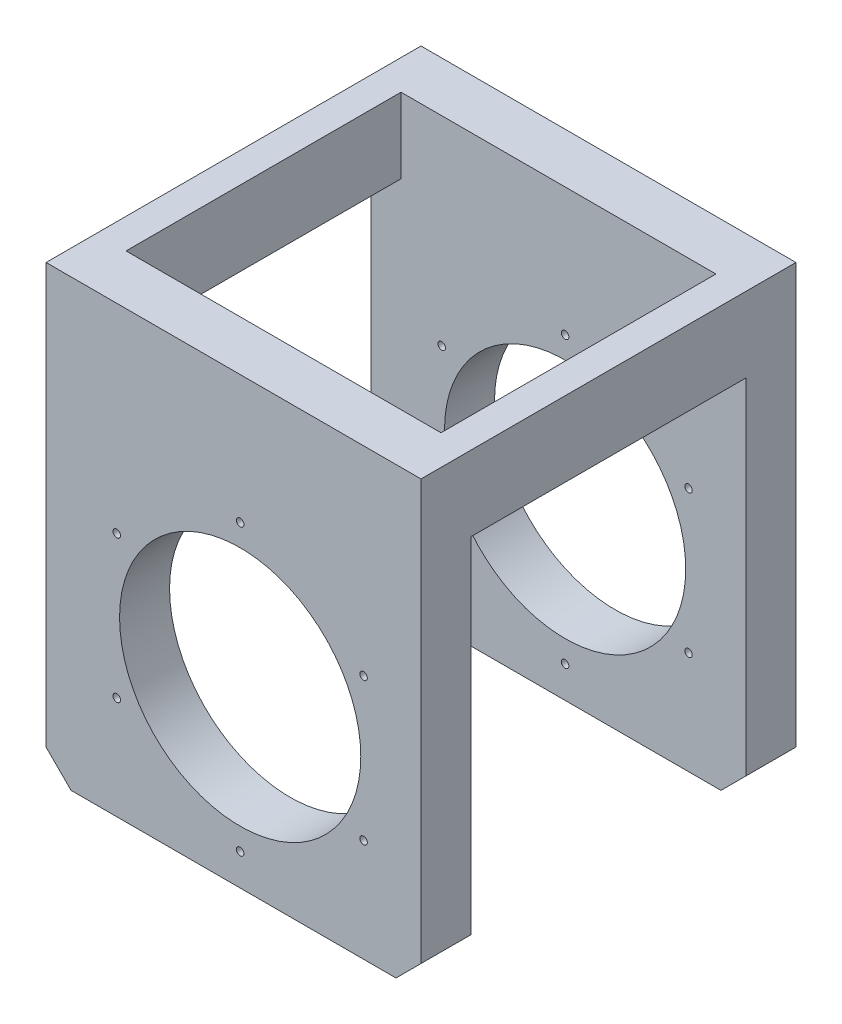
from build123d import *

# Parameters (mm, degrees)
EXTRUDE_1_OUTLINE_W     = 150
EXTRUDE_1_OUTLINE_H     = 400
EXTRUDE_1_OUTLINE_R     = 48.25
EXTRUDE_1_DEPTH         = 20
SKETCH_2_W              = 150
SKETCH_2_H              = 400
SKETCH_2_W_2            = 126
SKETCH_2_H_2            = 376
EXTRUDE_1_2_DEPTH       = 110
EXTRUDE_START           = 20
SKETCH_3_W              = 150
SKETCH_3_H              = 400
SKETCH_3_R              = 48.25
EXTRUDE_3_DEPTH         = 20
SKETCH_4_W              = 110
SKETCH_4_H              = 55
CUT_EXTRUDE_1_DEPTH     = 428.229446551
CHAMFER_2_SIZE          = 20
CHAMFER_3_SIZE          = 20
CUT_EXTRUDE_START       = 190
CUT_EXTRUDE_2_OUTLINE_W = 132
CUT_EXTRUDE_2_OUTLINE_H = 152
CUT_EXTRUDE_2_DEPTH     = 10
FILLET_1_R              = 20
FILLET_2_R              = 20
FILLET_3_R              = 20
FILLET_4_R              = 20
EXTRUDE_START_2         = -20
SKETCH_6_R              = 48.25
SKETCH_6_R_2            = 29.5
EXTRUDE_4_DEPTH         = 20
SKETCH_7_R              = 48.25
SKETCH_7_R_2            = 29.5
EXTRUDE_5_DEPTH         = 20
SKETCH_8_R              = 29.5
EXTRUDE_7_DEPTH         = 20
SKETCH_9_R              = 29.5
EXTRUDE_8_DEPTH         = 20
SKETCH_10_R             = 1.65
EXTRUDE_9_DEPTH         = 10
EXTRUDE_START_3         = 10
SKETCH_11_R             = 1.65
EXTRUDE_10_DEPTH        = 10
SKETCH_12_W             = 110
SKETCH_12_H             = 147.914448675
CUT_EXTRUDE_3_DEPTH     = 287.530975638
CHAMFER_4_SIZE          = 10
CHAMFER_5_SIZE          = 10
SKETCH_13_W             = 150
SKETCH_13_H             = 80
CUT_EXTRUDE_5_DEPTH     = 267.880122902
CUT_EXTRUDE_6_REACH     = 263.008
SKETCH_15_R             = 1.5
SKETCH_16_R             = 1.5
CUT_EXTRUDE_7_DEPTH     = 262.007662723


with BuildPart() as part:
    # Extrude 1: read off the stored shape, not the designer's step
    # Extrude 1 outline → Extrude 1 (new body)
    with BuildSketch(Plane.XY):
        Rectangle(EXTRUDE_1_OUTLINE_W, EXTRUDE_1_OUTLINE_H)
        with Locations((2.655190842, -130.335551325)):
            Circle(EXTRUDE_1_OUTLINE_R, mode=Mode.SUBTRACT)
        with Locations((0, 129.13990983)):
            Circle(EXTRUDE_1_OUTLINE_R, mode=Mode.SUBTRACT)
    extrude(amount=EXTRUDE_1_DEPTH)

    # 草图2 → Extrude 1 2 (add)
    with BuildSketch(Plane(origin=(0, 0, 0), x_dir=(-1, 0, 0), z_dir=(0, 0, -1))):
        Rectangle(SKETCH_2_W, SKETCH_2_H)
        Rectangle(SKETCH_2_W_2, SKETCH_2_H_2, mode=Mode.SUBTRACT)
    extrude(amount=EXTRUDE_1_2_DEPTH)

    # 草图3 → 凸台-拉伸3 (add)
    with BuildSketch(Plane(origin=(0, 0, -110), x_dir=(-1, 0, 0), z_dir=(0, 0, -1)).offset(EXTRUDE_START)):
        Rectangle(SKETCH_3_W, SKETCH_3_H)
        with Locations(Location((-2.655190842, -130.335551325, 0), (0, 0, 180))):
            Circle(SKETCH_3_R, mode=Mode.SUBTRACT)
        with Locations(Location((0, 129.13990983, 0), (0, 0, 180))):
            Circle(SKETCH_3_R, mode=Mode.SUBTRACT)
    extrude(amount=-EXTRUDE_3_DEPTH)

    # 草图4 → 切除-拉伸1 (cut, through all)
    with BuildSketch(Plane.XZ.offset(200)):
        with Locations((0, -27.5)):
            Rectangle(SKETCH_4_W, SKETCH_4_H)
        with Locations((0, -82.5)):
            Rectangle(SKETCH_4_W, SKETCH_4_H)
    extrude(amount=-CUT_EXTRUDE_1_DEPTH, mode=Mode.SUBTRACT)

    # 倒角2
    chamfer_2_edges = [part.edges().sort_by_distance(p)[0] for p in [
        (-75, 200, -55),
    ]]
    chamfer(chamfer_2_edges, length=CHAMFER_2_SIZE - 0.0001)  # a hair under: the kernel refuses the full size

    # 倒角3
    chamfer_3_edges = [part.edges().sort_by_distance(p)[0] for p in [
        (75, 200, -55),
    ]]
    chamfer(chamfer_3_edges, length=CHAMFER_3_SIZE - 0.0001)  # a hair under: the kernel refuses the full size

    # 切除-拉伸2: read off the stored shape, not the designer's step
    # 切除-拉伸2 outline → 切除-拉伸2 (cut)
    with BuildSketch(Plane(origin=(0, 0, 0), x_dir=(1, 0, 0), z_dir=(0, 1, 0)).offset(CUT_EXTRUDE_START)):
        with Locations((0, 55)):
            Rectangle(CUT_EXTRUDE_2_OUTLINE_W, CUT_EXTRUDE_2_OUTLINE_H)
    extrude(amount=CUT_EXTRUDE_2_DEPTH, mode=Mode.SUBTRACT)

    # 圆角1
    fillet_1_edges = [part.edges().sort_by_distance(p)[0] for p in [
        (-65.0001, 190, -55),
    ]]
    fillet(fillet_1_edges, radius=FILLET_1_R)

    # 圆角2
    fillet_2_edges = [part.edges().sort_by_distance(p)[0] for p in [
        (65.0001, 190, -55),
    ]]
    fillet(fillet_2_edges, radius=FILLET_2_R)

    # 圆角3
    # the kernel refuses this fillet: 20 mm, written as the material it takes off along each edge
    with BuildSketch(Plane(origin=(-75, 180.0001, 40.112615753), x_dir=(0.7071067811865488, 0.7071067811865464, 0), z_dir=(0, 0, -1))) as fillet_3_piece_1:
        with BuildLine():
            CenterArc((8.453428829, 19.830842418), FILLET_3_R, 225, 37.542814558)
            Line((-5.688706794, 5.688706794), (-5.971549507, 5.405864082))
            Line((-5.971549507, 5.405864082), (-0.282842712, -0.282842712))
            Line((-0.282842712, -0.282842712), (0, -0.4))
            ThreePointArc((0, -0.4), (2.928861477, -0.4), (5.805808837, -0.396616848))
            Line((5.805808837, -0.396616848), (5.857722955, 0))
        make_face()
    extrude(amount=190.225231505, mode=Mode.SUBTRACT)

    # 圆角4
    # the kernel refuses this fillet: 20 mm, written as the material it takes off along each edge
    with BuildSketch(Plane(origin=(75, 180.0001, -150.112615753), x_dir=(-0.7071067811865438, 0.7071067811865511, 0), z_dir=(0, 0, 1))) as fillet_4_piece_1:
        with BuildLine():
            CenterArc((8.453428829, 19.830842418), FILLET_4_R, 225, 37.542814558)
            Line((-5.688706794, 5.688706794), (-5.971549507, 5.405864082))
            Line((-5.971549507, 5.405864082), (-0.282842712, -0.282842712))
            Line((-0.282842712, -0.282842712), (0, -0.4))
            ThreePointArc((0, -0.4), (2.928861477, -0.4), (5.805808837, -0.396616848))
            Line((5.805808837, -0.396616848), (5.857722955, 0))
        make_face()
    extrude(amount=190.225231505, mode=Mode.SUBTRACT)

    # 草图6 → 凸台-拉伸4 (add)
    with BuildSketch(Plane.XY.offset(20).offset(EXTRUDE_START_2)):
        with Locations(Location((0, 129.13990983, 0), (0, 0, 180))):
            Circle(SKETCH_6_R)
        with Locations((0, 129.13990983)):
            Circle(SKETCH_6_R_2, mode=Mode.SUBTRACT)
    extrude(amount=EXTRUDE_4_DEPTH)

    # 草图7 → 凸台-拉伸5 (add)
    with BuildSketch(Plane(origin=(0, 0, -130), x_dir=(-1, 0, 0), z_dir=(0, 0, -1))):
        with Locations((0, 129.13990983)):
            Circle(SKETCH_7_R)
        with Locations(Location((0, 129.13990983, 0), (0, 0, 180))):
            Circle(SKETCH_7_R_2, mode=Mode.SUBTRACT)
    extrude(amount=-EXTRUDE_5_DEPTH)

    # 草图8 → 凸台-拉伸7 (add)
    with BuildSketch(Plane.XY.offset(20).offset(EXTRUDE_START_2)):
        with Locations(Location((0, 129.13990983, 0), (0, 0, 180))):
            Circle(SKETCH_8_R)
    extrude(amount=EXTRUDE_7_DEPTH)

    # 草图9 → 凸台-拉伸8 (add)
    with BuildSketch(Plane(origin=(0, 0, -130), x_dir=(-1, 0, 0), z_dir=(0, 0, -1))):
        with Locations((0, 129.13990983)):
            Circle(SKETCH_9_R)
    extrude(amount=-EXTRUDE_8_DEPTH)

    # 草图10 → 凸台-拉伸9 (add)
    with BuildSketch(Plane(origin=(0, 0, -130), x_dir=(-1, 0, 0), z_dir=(0, 0, -1))):
        with Locations((0, 146.38990983)):
            Circle(SKETCH_10_R)
        with Locations((14.938938215, 137.76490983)):
            Circle(SKETCH_10_R)
        with Locations((14.938938215, 120.51490983)):
            Circle(SKETCH_10_R)
        with Locations((0, 111.88990983)):
            Circle(SKETCH_10_R)
        with Locations((-14.938938215, 120.51490983)):
            Circle(SKETCH_10_R)
        with Locations((-14.938938215, 137.76490983)):
            Circle(SKETCH_10_R)
    extrude(amount=EXTRUDE_9_DEPTH)

    # 草图11 → 凸台-拉伸10 (add)
    with BuildSketch(Plane.XY.offset(20).offset(EXTRUDE_START_3)):
        with Locations(Location((-14.938938215, 137.76490983, 0), (0, 0, 180))):
            Circle(SKETCH_11_R)
        with Locations(Location((-14.938938215, 120.51490983, 0), (0, 0, 180))):
            Circle(SKETCH_11_R)
        with Locations(Location((0, 111.88990983, 0), (0, 0, 180))):
            Circle(SKETCH_11_R)
        with Locations(Location((14.938938215, 120.51490983, 0), (0, 0, 180))):
            Circle(SKETCH_11_R)
        with Locations(Location((0, 146.38990983, 0), (0, 0, 180))):
            Circle(SKETCH_11_R)
        with Locations(Location((14.938938215, 137.76490983, 0), (0, 0, 180))):
            Circle(SKETCH_11_R)
    extrude(amount=-EXTRUDE_10_DEPTH)

    # 草图12 → 切除-拉伸3 (cut, through all)
    with BuildSketch(Plane.ZY.offset(75)):
        with Locations((-55, -126.042775663)):
            Rectangle(SKETCH_12_W, SKETCH_12_H)
    extrude(amount=-CUT_EXTRUDE_3_DEPTH, mode=Mode.SUBTRACT)

    # 倒角4
    chamfer_4_edges = [part.edges().sort_by_distance(p)[0] for p in [
        (-75, -200, -120),
    ]]
    chamfer(chamfer_4_edges, length=CHAMFER_4_SIZE)

    # 倒角5
    chamfer_5_edges = [part.edges().sort_by_distance(p)[0] for p in [
        (75, -200, -120),
        (-75, -200, 10),
        (75, -200, 10),
    ]]
    chamfer(chamfer_5_edges, length=CHAMFER_5_SIZE)

    # 草图13 → 切除-拉伸5 (cut, through all)
    with BuildSketch(Plane.XY.offset(20)):
        with Locations((0, 17.914448675)):
            Rectangle(SKETCH_13_W, SKETCH_13_H)
    extrude(amount=-CUT_EXTRUDE_5_DEPTH, mode=Mode.SUBTRACT)


with BuildPart() as body_2:
    # of the pieces the cut leaves, the one that is kept (cut_extrude_5_keep)
    add(part.part.solids().sort_by_distance((65, -200, -110))[0])

    # 草图15 → 切除-拉伸6 (cut, up to next)
    with BuildSketch(Plane.XY.offset(20), mode=Mode.PRIVATE) as cut_extrude_6_sk1:
        with Locations((2.655190842, -73.335551325)):
            Circle(SKETCH_15_R)
    cut_extrude_6_tool1 = extrude(cut_extrude_6_sk1.sketch, amount=-CUT_EXTRUDE_6_REACH, mode=Mode.PRIVATE) & body_2.part
    # 草图15 → 切除-拉伸6 (cut, up to next)
    with BuildSketch(Plane.XY.offset(20), mode=Mode.PRIVATE) as cut_extrude_6_sk2:
        with Locations((52.018638858, -101.835551325)):
            Circle(SKETCH_15_R)
    cut_extrude_6_tool2 = extrude(cut_extrude_6_sk2.sketch, amount=-CUT_EXTRUDE_6_REACH, mode=Mode.PRIVATE) & body_2.part
    # 草图15 → 切除-拉伸6 (cut, up to next)
    with BuildSketch(Plane.XY.offset(20), mode=Mode.PRIVATE) as cut_extrude_6_sk3:
        with Locations((52.018638858, -158.835551325)):
            Circle(SKETCH_15_R)
    cut_extrude_6_tool3 = extrude(cut_extrude_6_sk3.sketch, amount=-CUT_EXTRUDE_6_REACH, mode=Mode.PRIVATE) & body_2.part
    # 草图15 → 切除-拉伸6 (cut, up to next)
    with BuildSketch(Plane.XY.offset(20), mode=Mode.PRIVATE) as cut_extrude_6_sk4:
        with Locations((2.655190842, -187.335551325)):
            Circle(SKETCH_15_R)
    cut_extrude_6_tool4 = extrude(cut_extrude_6_sk4.sketch, amount=-CUT_EXTRUDE_6_REACH, mode=Mode.PRIVATE) & body_2.part
    # 草图15 → 切除-拉伸6 (cut, up to next)
    with BuildSketch(Plane.XY.offset(20), mode=Mode.PRIVATE) as cut_extrude_6_sk5:
        with Locations((-46.708257174, -158.835551325)):
            Circle(SKETCH_15_R)
    cut_extrude_6_tool5 = extrude(cut_extrude_6_sk5.sketch, amount=-CUT_EXTRUDE_6_REACH, mode=Mode.PRIVATE) & body_2.part
    # 草图15 → 切除-拉伸6 (cut, up to next)
    with BuildSketch(Plane.XY.offset(20), mode=Mode.PRIVATE) as cut_extrude_6_sk6:
        with Locations((-46.708257174, -101.835551325)):
            Circle(SKETCH_15_R)
    cut_extrude_6_tool6 = extrude(cut_extrude_6_sk6.sketch, amount=-CUT_EXTRUDE_6_REACH, mode=Mode.PRIVATE) & body_2.part
    add(cut_extrude_6_tool1.solids().sort_by_distance((2.655191, -73.335551, 20))[0], mode=Mode.SUBTRACT)
    add(cut_extrude_6_tool2.solids().sort_by_distance((52.018639, -101.835551, 20))[0], mode=Mode.SUBTRACT)
    add(cut_extrude_6_tool3.solids().sort_by_distance((52.018639, -158.835551, 20))[0], mode=Mode.SUBTRACT)
    add(cut_extrude_6_tool4.solids().sort_by_distance((2.655191, -187.335551, 20))[0], mode=Mode.SUBTRACT)
    add(cut_extrude_6_tool5.solids().sort_by_distance((-46.708257, -158.835551, 20))[0], mode=Mode.SUBTRACT)
    add(cut_extrude_6_tool6.solids().sort_by_distance((-46.708257, -101.835551, 20))[0], mode=Mode.SUBTRACT)

    # 草图16 → 切除-拉伸7 (cut, through all)
    with BuildSketch(Plane(origin=(0, 0, -130), x_dir=(-1, 0, 0), z_dir=(0, 0, -1))):
        with Locations(Location((-52.018638858, -101.835551325, 0), (0, 0, 180))):
            Circle(SKETCH_16_R)
        with Locations(Location((-2.655190842, -73.335551325, 0), (0, 0, 180))):
            Circle(SKETCH_16_R)
        with Locations(Location((46.708257174, -158.835551325, 0), (0, 0, 180))):
            Circle(SKETCH_16_R)
        with Locations(Location((-52.018638858, -158.835551325, 0), (0, 0, 180))):
            Circle(SKETCH_16_R)
        with Locations(Location((-2.655190842, -187.335551325, 0), (0, 0, 180))):
            Circle(SKETCH_16_R)
        with Locations(Location((46.708257174, -101.835551325, 0), (0, 0, 180))):
            Circle(SKETCH_16_R)
    extrude(amount=-CUT_EXTRUDE_7_DEPTH, mode=Mode.SUBTRACT)


solid = body_2.part
